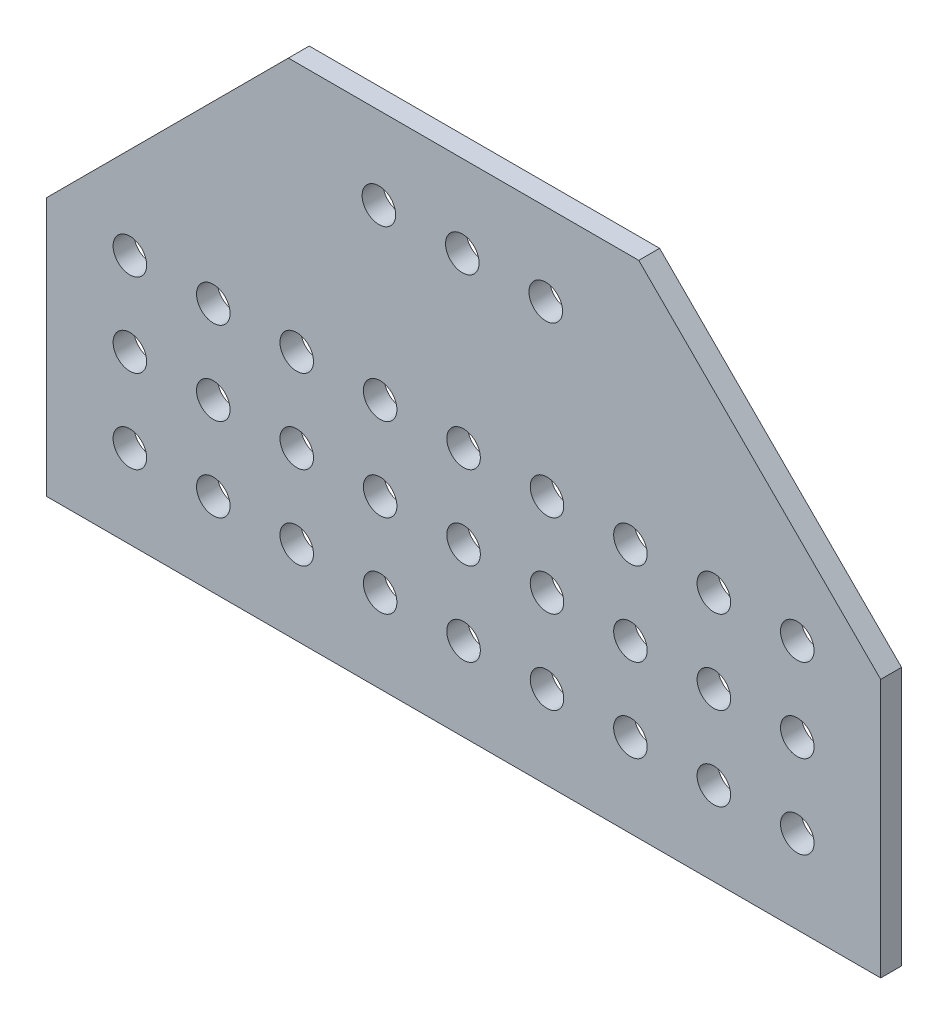
from build123d import *

# Parameters (mm, degrees)
SKETCH1_W               = 127
SKETCH1_H               = 82.55
BOSS_EXTRUDE1_DEPTH     = 3.175
CUT_EXTRUDE1_DEPTH      = 152.504399689
CUT_EXTRUDE1_DEPTH_BACK = 152.504399689
SKETCH2_R               = 2.5527
SKETCH3_R               = 2.5527
CUT_EXTRUDE2_DEPTH      = 152.504399689
CUT_EXTRUDE3_DEPTH      = 152.504399689
CUT_EXTRUDE4_DEPTH      = 152.504399689


with BuildPart() as part:
    # Sketch1 → Boss-Extrude1 (new body)
    with BuildSketch(Plane.XY):
        with Locations((63.5, 41.275)):
            Rectangle(SKETCH1_W, SKETCH1_H)
    extrude(amount=BOSS_EXTRUDE1_DEPTH)

    # Sketch2 → Cut-Extrude1 (cut, two sides: drawn at the far end of the back side and taken through both)
    with BuildSketch(Plane(origin=(0, 0, 0), x_dir=(-1, 0, 0), z_dir=(0, 0, -1)).offset(-CUT_EXTRUDE1_DEPTH_BACK)):
        with Locations((-76.0095, 63.6905)):
            Circle(SKETCH2_R)
        with Locations((-63.3095, 63.6905)):
            Circle(SKETCH2_R)
        with Locations((-50.6095, 63.6905)):
            Circle(SKETCH2_R)
    extrude(amount=CUT_EXTRUDE1_DEPTH + CUT_EXTRUDE1_DEPTH_BACK, mode=Mode.SUBTRACT)

    # Sketch3 → Cut-Extrude2 (cut, through all)
    with BuildSketch(Plane(origin=(0, 0, 0), x_dir=(-1, 0, 0), z_dir=(0, 0, -1))):
        with Locations((-114.3, 38.1)):
            Circle(SKETCH3_R)
        with Locations((-114.3, 25.4)):
            Circle(SKETCH3_R)
        with Locations((-114.3, 12.7)):
            Circle(SKETCH3_R)
        with Locations((-101.6, 38.1)):
            Circle(SKETCH3_R)
        with Locations((-101.6, 25.4)):
            Circle(SKETCH3_R)
        with Locations((-101.6, 12.7)):
            Circle(SKETCH3_R)
        with Locations((-88.9, 38.1)):
            Circle(SKETCH3_R)
        with Locations((-88.9, 25.4)):
            Circle(SKETCH3_R)
        with Locations((-88.9, 12.7)):
            Circle(SKETCH3_R)
        with Locations((-76.2, 38.1)):
            Circle(SKETCH3_R)
        with Locations((-76.2, 25.4)):
            Circle(SKETCH3_R)
        with Locations((-76.2, 12.7)):
            Circle(SKETCH3_R)
        with Locations((-63.5, 38.1)):
            Circle(SKETCH3_R)
        with Locations((-63.5, 25.4)):
            Circle(SKETCH3_R)
        with Locations((-63.5, 12.7)):
            Circle(SKETCH3_R)
        with Locations((-50.8, 38.1)):
            Circle(SKETCH3_R)
        with Locations((-50.8, 25.4)):
            Circle(SKETCH3_R)
        with Locations((-50.8, 12.7)):
            Circle(SKETCH3_R)
        with Locations((-38.1, 38.1)):
            Circle(SKETCH3_R)
        with Locations((-38.1, 25.4)):
            Circle(SKETCH3_R)
        with Locations((-38.1, 12.7)):
            Circle(SKETCH3_R)
        with Locations((-25.4, 38.1)):
            Circle(SKETCH3_R)
        with Locations((-25.4, 25.4)):
            Circle(SKETCH3_R)
        with Locations((-25.4, 12.7)):
            Circle(SKETCH3_R)
        with Locations((-12.7, 38.1)):
            Circle(SKETCH3_R)
        with Locations((-12.7, 25.4)):
            Circle(SKETCH3_R)
        with Locations((-12.7, 12.7)):
            Circle(SKETCH3_R)
    extrude(amount=-CUT_EXTRUDE2_DEPTH, mode=Mode.SUBTRACT)

    # Sketch4 → Cut-Extrude3 (cut, through all)
    with BuildSketch(Plane(origin=(0, 0, 0), x_dir=(-1, 0, 0), z_dir=(0, 0, -1))):
        Polygon((-83.82, 82.55), (-127, 39.37), (-127, 82.55), align=None)
        Polygon((-43.18, 82.55), (0, 82.55), (0, 39.37), align=None)
    extrude(amount=-CUT_EXTRUDE3_DEPTH, mode=Mode.SUBTRACT)

    # Sketch5 → Cut-Extrude4 (cut, through all)
    with BuildSketch(Plane(origin=(0, 0, 0), x_dir=(-1, 0, 0), z_dir=(0, 0, -1))):
        Polygon((-90.17, 76.2), (-36.83, 76.2), (-43.18, 82.55), (-83.82, 82.55), align=None)
    extrude(amount=-CUT_EXTRUDE4_DEPTH, mode=Mode.SUBTRACT)


solid = part.part
